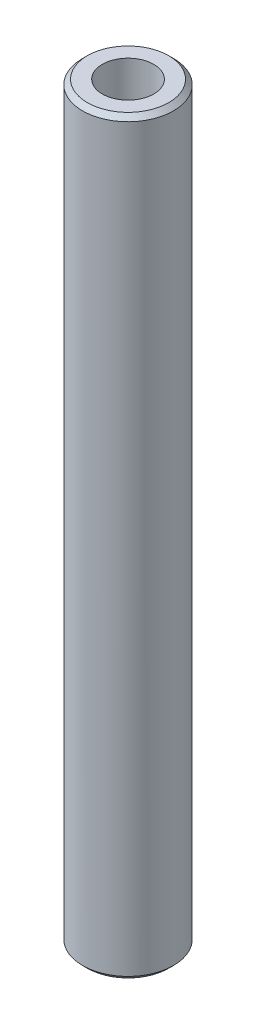
from build123d import *

# Parameters (mm, degrees)
SKETCH1_R           = 30
BOSS_EXTRUDE1_DEPTH = 494.81940058
SKETCH2_R           = 16.981375194
CUT_EXTRUDE1_DEPTH  = 497.634915396
CHAMFER1_SIZE       = 3.14745717


with BuildPart() as part:
    # Sketch1 → Boss-Extrude1 (new body)
    with BuildSketch(Plane(origin=(0, 0, 0), x_dir=(1, 0, 0), z_dir=(0, 1, 0))):
        Circle(SKETCH1_R)
    extrude(amount=BOSS_EXTRUDE1_DEPTH)

    # Sketch2 → Cut-Extrude1 (cut, through all)
    with BuildSketch(Plane(origin=(0, 0, 0), x_dir=(1, 0, 0), z_dir=(0, 1, 0))):
        Circle(SKETCH2_R)
    extrude(amount=CUT_EXTRUDE1_DEPTH, mode=Mode.SUBTRACT)

    # Chamfer1
    chamfer1_edges = [part.edges().sort_by_distance(p)[0] for p in [
        (-30, 494.81940058, 0),
        (-30, 0, 0),
    ]]
    chamfer(chamfer1_edges, length=CHAMFER1_SIZE)


solid = part.part
